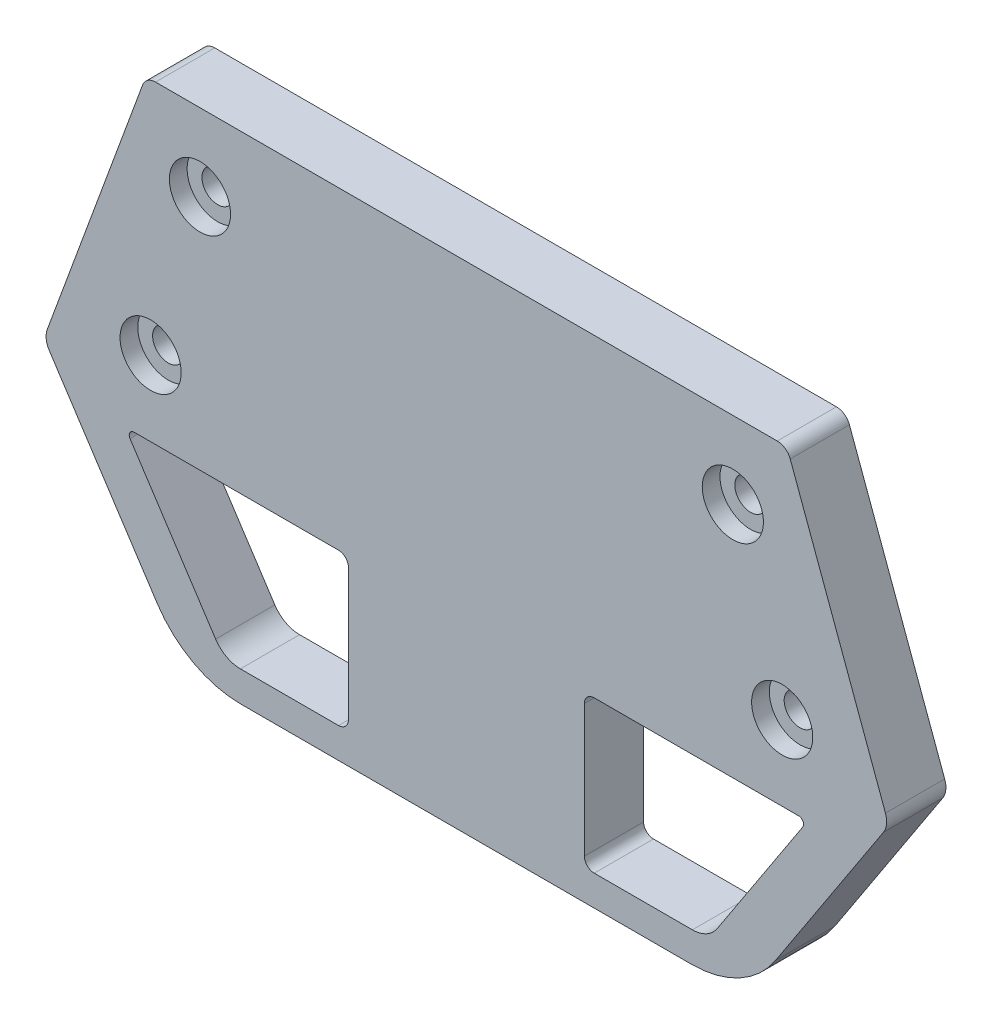
from build123d import *

# Parameters (mm, degrees)
BOSS_EXTRUDE1_DEPTH = 7.62
CUT_EXTRUDE4_DEPTH  = 65.443482206
SKETCH8_R           = 2.032
CUT_EXTRUDE6_DEPTH  = 65.443482206
SKETCH9_R           = 2.032
CUT_EXTRUDE7_DEPTH  = 25.4
SKETCH11_R          = 3.937
CUT_EXTRUDE9_DEPTH  = 2.286


with BuildPart() as part:
    # Sketch2 → Boss-Extrude1 (new body)
    with BuildSketch(Plane.XY):
        with BuildLine():
            Line((-53.9331315, -0.315391151), (-41.673792668, 33.030010472))
            ThreePointArc((-41.673792668, 33.030010472), (-41.022456018, 33.874587748), (-40.005, 34.194483756))
            Line((-40.005, 34.194483756), (40.005, 34.194483756))
            ThreePointArc((40.005, 34.194483756), (41.022456018, 33.874587748), (41.673792668, 33.030010472))
            Line((41.673792668, 33.030010472), (53.9331315, -0.315391151))
            ThreePointArc((53.9331315, -0.315391151), (54.072783991, -1.479661595), (53.674573059, -2.582592481))
            Line((53.674573059, -2.582592481), (39.780650937, -23.816388011))
            ThreePointArc((39.780650937, -23.816388011), (35.127277075, -28.095614939), (28.998611748, -29.64646397))
            Line((28.998611748, -29.64646397), (-28.998611748, -29.64646397))
            ThreePointArc((-28.998611748, -29.64646397), (-35.127277075, -28.095614939), (-39.780650937, -23.816388011))
            Line((-39.780650937, -23.816388011), (-53.674573059, -2.582592481))
            ThreePointArc((-53.674573059, -2.582592481), (-54.072783991, -1.479661595), (-53.9331315, -0.315391151))
        make_face()
    extrude(amount=BOSS_EXTRUDE1_DEPTH)

    # Sketch6 → Cut-Extrude4 (cut, through all)
    with BuildSketch(Plane.XY.offset(7.62)):
        with BuildLine():
            Line((-43.288518763, -7.189330581), (-32.273407011, -24.02349941))
            ThreePointArc((-32.273407011, -24.02349941), (-30.897448537, -25.288826187), (-29.085260384, -25.747397522))
            Line((-29.085260384, -25.747397522), (-16.452977044, -25.747397522))
            ThreePointArc((-16.452977044, -25.747397522), (-15.554951432, -25.375423134), (-15.182977044, -24.477397522))
            Line((-15.182977044, -24.477397522), (-15.182977044, -7.476646933))
            ThreePointArc((-15.182977044, -7.476646933), (-15.554951432, -6.578621321), (-16.452977044, -6.206646933))
            Line((-16.452977044, -6.206646933), (-42.757160992, -6.206646933))
            ThreePointArc((-42.757160992, -6.206646933), (-43.315732436, -6.539615574), (-43.288518763, -7.189330581))
        make_face()
        with BuildLine():
            Line((43.288518763, -7.189330581), (32.273407011, -24.02349941))
            ThreePointArc((32.273407011, -24.02349941), (30.897448537, -25.288826187), (29.085260384, -25.747397522))
            Line((29.085260384, -25.747397522), (16.452977044, -25.747397522))
            ThreePointArc((16.452977044, -25.747397522), (15.554951432, -25.375423134), (15.182977044, -24.477397522))
            Line((15.182977044, -24.477397522), (15.182977044, -7.476646933))
            ThreePointArc((15.182977044, -7.476646933), (15.554951432, -6.578621321), (16.452977044, -6.206646933))
            Line((16.452977044, -6.206646933), (42.757160992, -6.206646933))
            ThreePointArc((42.757160992, -6.206646933), (43.315732436, -6.539615574), (43.288518763, -7.189330581))
        make_face()
    extrude(amount=-CUT_EXTRUDE4_DEPTH, mode=Mode.SUBTRACT)

    # Sketch8 → Cut-Extrude6 (cut, through all)
    with BuildSketch(Plane.XY.offset(7.62)):
        with Locations((-40.64, 3.445353067)):
            Circle(SKETCH8_R)
        with Locations((-34.29, 24.273353067)):
            Circle(SKETCH8_R)
        with Locations((40.64, 3.445353067)):
            Circle(SKETCH8_R)
        with Locations((34.29, 24.273353067)):
            Circle(SKETCH8_R)
    extrude(amount=-CUT_EXTRUDE6_DEPTH, mode=Mode.SUBTRACT)

    # Sketch9 → Cut-Extrude7 (cut)
    with BuildSketch(Plane.XZ.offset(29.64646397)):
        with Locations((0, 3.81)):
            Circle(SKETCH9_R)
    extrude(amount=-CUT_EXTRUDE7_DEPTH, mode=Mode.SUBTRACT)

    # Sketch11 → Cut-Extrude9 (cut)
    with BuildSketch(Plane.XY.offset(7.62)):
        with Locations((-34.29, 24.273353067)):
            Circle(SKETCH11_R)
        with Locations((-40.64, 3.445353067)):
            Circle(SKETCH11_R)
        with Locations((40.64, 3.445353067)):
            Circle(SKETCH11_R)
        with Locations((34.29, 24.273353067)):
            Circle(SKETCH11_R)
    extrude(amount=-CUT_EXTRUDE9_DEPTH, mode=Mode.SUBTRACT)


solid = part.part
